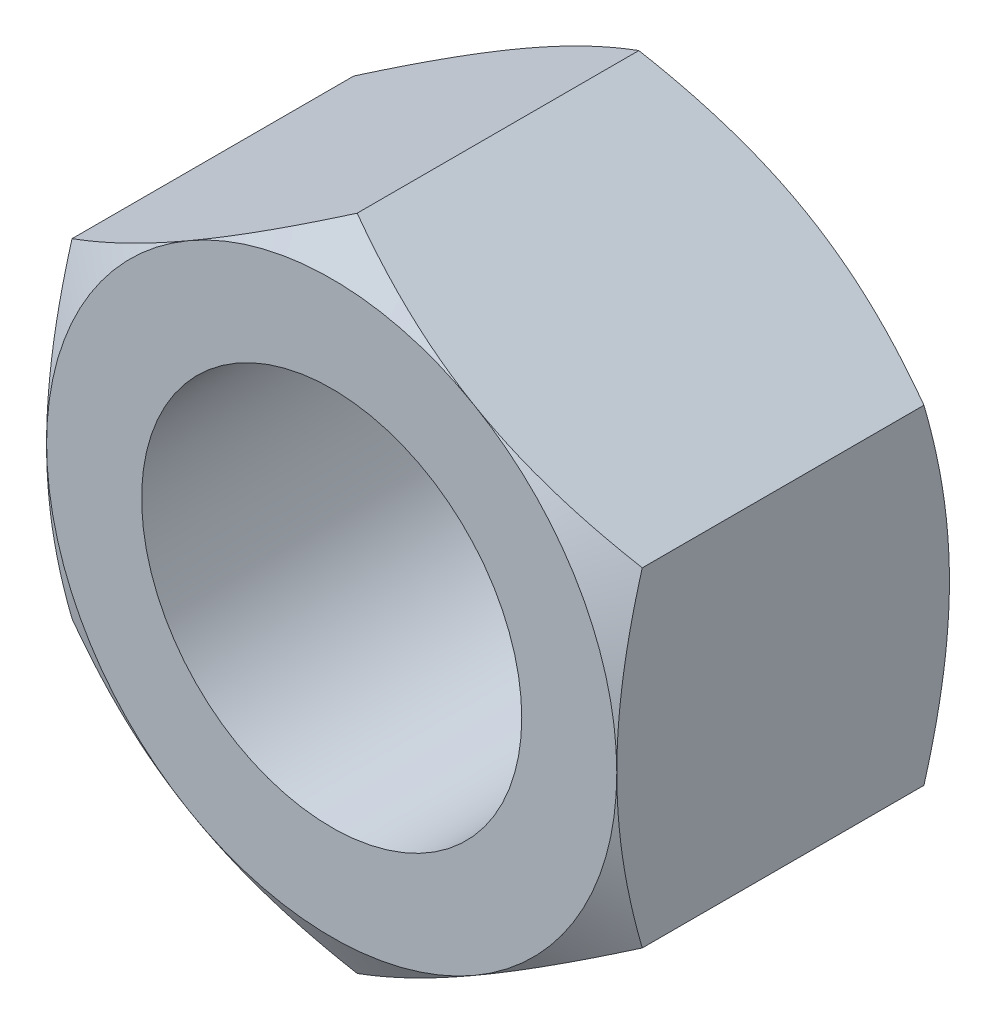
from build123d import *

# Parameters (mm, degrees)
SKETCH1_R               = 4.7625
EXTRUDE1_DEPTH          = 4.1671875
SKETCH7_OUTSIDE_W       = 108.948
SKETCH7_OUTSIDE_H       = 111.158
SKETCH7_OUTSIDE_R       = 7.14375
EXTRUDE2_DEPTH          = 25.4
EXTRUDE2_DRAFT          = -60
MIRROR1_COPY_1_SKETCH_W = 108.948
MIRROR1_COPY_1_SKETCH_H = 111.158
MIRROR1_COPY_1_SKETCH_R = 7.14375
MIRROR1_COPY_1_DEPTH    = 25.4
MIRROR1_COPY_1_DRAFT    = -60


with BuildPart() as part:
    # Sketch1 → Extrude1 (new, symmetric)
    with BuildSketch(Plane.XY):
        Polygon((-7.14375, 4.124445986), (-7.14375, -4.124445986), (0, -8.248891971), (7.14375, -4.124445986), (7.14375, 4.124445986), (0, 8.248891971), align=None)
        Circle(SKETCH1_R, mode=Mode.SUBTRACT)
    extrude(amount=EXTRUDE1_DEPTH, both=True)


with BuildPart() as extrude2_tool:
    # Sketch7 outside → Extrude2 (with draft: the straight prism first)
    with BuildSketch(Plane.XY.offset(4.1671875)):
        Rectangle(SKETCH7_OUTSIDE_W, SKETCH7_OUTSIDE_H)
        Circle(SKETCH7_OUTSIDE_R, mode=Mode.SUBTRACT)
    extrude(amount=-EXTRUDE2_DEPTH)
    # Extrude2: the draft: its side faces are tilted about the plane it starts from
    extrude2_sides = [extrude2_tool.faces().sort_by_distance(p)[0] for p in [
        (0, -55.579, -8.5328125),
        (54.474, 0, -8.5328125),
        (0, 55.579, -8.5328125),
        (-54.474, 0, -8.5328125),
        (-7.14375, 0, -8.5328125),
    ]]
    draft(extrude2_sides, Plane.XY.offset(4.1671875), EXTRUDE2_DRAFT)


with BuildPart() as part_1:
    add(part.part)

    # Extrude2: cut by extrude2_tool
    add(extrude2_tool.part, mode=Mode.SUBTRACT)


with BuildPart() as mirror1_copy_1_tool:
    # Mirror1 copy 1 sketch → Mirror1 copy 1 (with draft: the straight prism first)
    with BuildSketch(Plane(origin=(0, 0, -4.1671875), x_dir=(1, 0, 0), z_dir=(0, 0, -1))):
        Rectangle(MIRROR1_COPY_1_SKETCH_W, MIRROR1_COPY_1_SKETCH_H)
        Circle(MIRROR1_COPY_1_SKETCH_R, mode=Mode.SUBTRACT)
    extrude(amount=-MIRROR1_COPY_1_DEPTH)
    # Mirror1 copy 1: the draft: its side faces are tilted about the plane it starts from
    mirror1_copy_1_sides = [mirror1_copy_1_tool.faces().sort_by_distance(p)[0] for p in [
        (0, -55.579, 8.5328125),
        (54.474, 0, 8.5328125),
        (0, 55.579, 8.5328125),
        (-54.474, 0, 8.5328125),
        (-7.14375, 0, 8.5328125),
    ]]
    draft(mirror1_copy_1_sides, Plane(origin=(0, 0, -4.1671875), x_dir=(1, 0, 0), z_dir=(0, 0, -1)), MIRROR1_COPY_1_DRAFT)


with BuildPart() as part_2:
    add(part_1.part)

    # Mirror1 copy 1: cut by mirror1_copy_1_tool
    add(mirror1_copy_1_tool.part, mode=Mode.SUBTRACT)


solid = part_2.part
